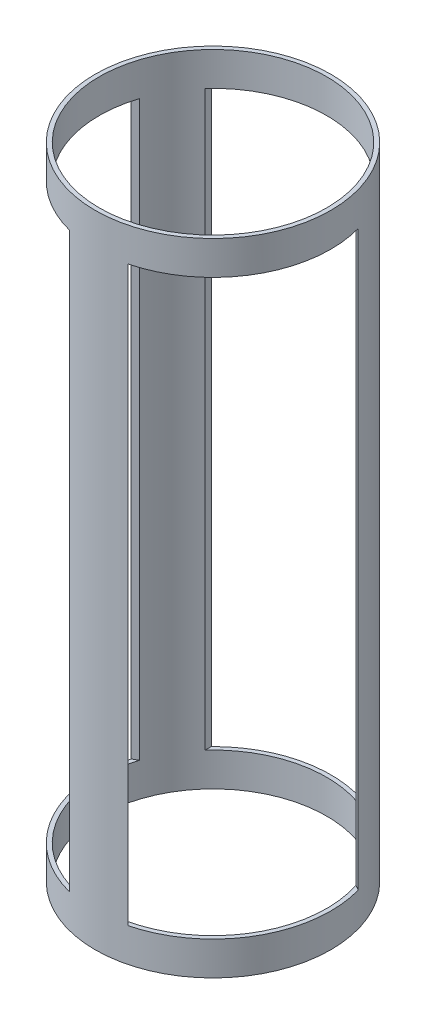
from build123d import *

# Parameters (mm, degrees)
SKETCH1_R               = 88.9
SKETCH1_R_2             = 85.725
BOSS_EXTRUDE1_DEPTH     = 241.427
CUT_EXTRUDE1_REACH      = 274.201
CUT_EXTRUDE1_END_RADIUS = 88.9
SKETCH2_W               = 127
SKETCH2_H               = 432.054
CIRPATTERN1_COUNT       = 3


with BuildPart() as part:
    # Sketch1 → Boss-Extrude1 (new, symmetric)
    with BuildSketch(Plane(origin=(0, 0, 0), x_dir=(1, 0, 0), z_dir=(0, 1, 0))):
        Circle(SKETCH1_R)
        Circle(SKETCH1_R_2, mode=Mode.SUBTRACT)
    extrude(amount=BOSS_EXTRUDE1_DEPTH, both=True)

    # Cut-Extrude1: up to this cylinder (the profile starts inside it)
    cut_extrude1_end = Plane(origin=(0, 0, 0), z_dir=(0, -1, 0)) * Cylinder(CUT_EXTRUDE1_END_RADIUS, 727.202, mode=Mode.PRIVATE)
    # Sketch2 → Cut-Extrude1 (cut, up to the surface)
    with BuildSketch(Plane.XY, mode=Mode.PRIVATE) as cut_extrude1_sk1:
        Rectangle(SKETCH2_W, SKETCH2_H)
    cut_extrude1_tool1 = extrude(cut_extrude1_sk1.sketch, amount=-CUT_EXTRUDE1_REACH, mode=Mode.PRIVATE) & cut_extrude1_end
    cut_extrude1 = cut_extrude1_tool1.solids().sort_by_distance((0, 0, 0))[0]
    add(cut_extrude1, mode=Mode.SUBTRACT)

    # CirPattern1: Cut-Extrude1 ×3 about axis
    cirpattern1_axis = Axis((0, 241.427, 0), (0, -1, 0))
    for i in range(1, CIRPATTERN1_COUNT):
        add(cut_extrude1.rotate(cirpattern1_axis, i * 360 / CIRPATTERN1_COUNT), mode=Mode.SUBTRACT)


solid = part.part
